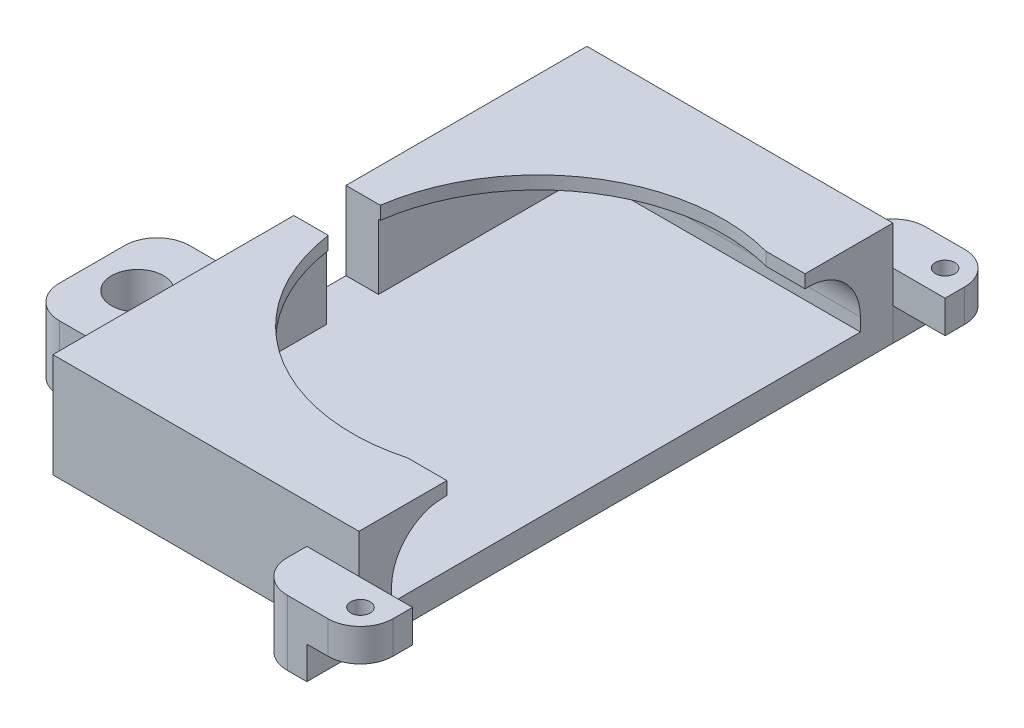
from build123d import *

# Parameters (mm, degrees)
BOSS_EXTRUDE2_DEPTH   = 14
CUT_EXTRUDE1_START    = -10
CUT_EXTRUDE1_DEPTH    = 93.322536556
BOSS_EXTRUDE3_DEPTH   = 2
FILLET6_R             = 8
SKETCH7_W             = 0.005
SKETCH7_H             = 82
CUT_EXTRUDE3_DEPTH    = 83.686153771
BOSS_EXTRUDE4_DEPTH   = 8
BOSS_EXTRUDE5_START   = -2
SKETCH12_W            = 8.228592419
SKETCH12_H            = 4.95
BOSS_EXTRUDE5_DEPTH   = 10
SKETCH9_R             = 1.5
CUT_EXTRUDE4_DEPTH    = 87.029065006
BOSS_EXTRUDE6_DEPTH   = 8
BOSS_EXTRUDE15_START  = -2
SKETCH15_W            = 7.945
SKETCH15_H            = 4.95
BOSS_EXTRUDE15_DEPTH  = 10
SKETCH16_R            = 1.5
CUT_EXTRUDE5_DEPTH    = 87.029065006
FILLET9_R             = 5
FILLET10_R            = 5
FILLET11_R            = 5
FILLET12_R            = 5
FILLET13_R            = 5
BOSS_EXTRUDE16_START  = -4
BOSS_EXTRUDE16_DEPTH  = 10
SKETCH18_R            = 4
CUT_EXTRUDE6_DEPTH    = 93.915997839
SKETCH19_W            = 20
SKETCH19_H            = 10
BOSS_EXTRUDE17_DEPTH  = 15
SKETCH20_R            = 4
CUT_EXTRUDE7_DEPTH    = 93.915997839
FILLET14_R            = 5
CUT_EXTRUDE9_START    = -5.282098
SKETCH21_W            = 8
SKETCH21_H            = 12
CUT_EXTRUDE9_DEPTH    = 5.282098
CROQUIS1_W            = 114.881967112
CROQUIS1_H            = 161.64199769
CORTAR_EXTRUIR2_DEPTH = 4.95
CROQUIS2_W            = 88.205530212
CROQUIS2_H            = 82
CORTAR_EXTRUIR3_DEPTH = 51.95


with BuildPart() as part:
    # Sketch1 → Boss-Extrude2 (new body)
    with BuildSketch(Plane(origin=(0, 0, 0), x_dir=(1, 0, 0), z_dir=(0, 1, 0))):
        with BuildLine():
            Line((0, 41), (-47, 41))
            Line((-47, 41), (-47, -41))
            Line((-47, -41), (0, -41))
            add(Edge.make_bspline(
                [(0, -41), (70, -41), (70, 0), (70, 41), (0, 41)],
                knots=[4.71238898, 4.71238898, 4.71238898, 6.283185307, 6.283185307, 7.853981634, 7.853981634, 7.853981634], degree=2, weights=[1, 0.707106781, 1, 0.707106781, 1]))
        make_face()
    extrude(amount=BOSS_EXTRUDE2_DEPTH)

    # Sketch3 → Cut-Extrude1 (cut, through all)
    with BuildSketch(Plane(origin=(0, 14, 0), x_dir=(1, 0, 0), z_dir=(0, 1, 0)).offset(CUT_EXTRUDE1_START)):
        with BuildLine():
            Line((0, 36), (-42, 36))
            Line((-42, 36), (-42, -36))
            Line((-42, -36), (0, -36))
            add(Edge.make_bspline(
                [(0, -36), (65, -36), (65, 0), (65, 36), (0, 36)],
                knots=[4.71238898, 4.71238898, 4.71238898, 6.283185307, 6.283185307, 7.853981634, 7.853981634, 7.853981634], degree=2, weights=[1, 0.707106781, 1, 0.707106781, 1]))
        make_face()
    extrude(amount=CUT_EXTRUDE1_DEPTH, mode=Mode.SUBTRACT)

    # Sketch5 → Boss-Extrude3 (add)
    with BuildSketch(Plane(origin=(0, 14, 0), x_dir=(1, 0, 0), z_dir=(0, 1, 0))):
        with BuildLine():
            Line((-47, 41), (-47, -41))
            Line((-47, -41), (0, -41))
            add(Edge.make_bspline(
                [(0, -41), (70, -41), (70, 0), (70, 41), (0, 41)],
                knots=[4.71238898, 4.71238898, 4.71238898, 6.283185307, 6.283185307, 7.853981634, 7.853981634, 7.853981634], degree=2, weights=[1, 0.707106781, 1, 0.707106781, 1]))
            Line((0, 41), (-47, 41))
        make_face()
        with BuildLine():
            Line((8.5, 27.5), (-6.016685226, 27.5))
            ThreePointArc((-6.016685226, 27.5), (-42, 0), (-6.016685226, -27.5))
            Line((-6.016685226, -27.5), (8.5, -27.5))
            add(Edge.make_bspline(
                [(8.5, -27.5), (58.152777778, -27.5), (58.152777778, 0), (58.152777778, 27.5), (8.5, 27.5)],
                knots=[1.570796327, 1.570796327, 1.570796327, 3.141592654, 3.141592654, 4.71238898, 4.71238898, 4.71238898], degree=2, weights=[1, 0.707106781, 1, 0.707106781, 1]))
        make_face(mode=Mode.SUBTRACT)
    extrude(amount=BOSS_EXTRUDE3_DEPTH)

    # Fillet6
    fillet6_edges = [part.edges().sort_by_distance(p)[0] for p in [
        (-21, 14, 36),
        (65, 14, 0),
        (-21, 14, -36),
    ]]
    fillet(fillet6_edges, radius=FILLET6_R)

    # Sketch7 → Cut-Extrude3 (cut, through all)
    with BuildSketch(Plane(origin=(0, 16, 0), x_dir=(1, 0, 0), z_dir=(0, 1, 0))):
        with Locations((-0.0025, 0)):
            Rectangle(SKETCH7_W, SKETCH7_H)
    extrude(amount=-CUT_EXTRUDE3_DEPTH, mode=Mode.SUBTRACT)


with BuildPart() as cut_extrude3_piece_1:
    # of the separate pieces the step leaves, piece 1, a body of its own (cut_extrude3_pieces)
    add(part.part.solids().sort_by_distance((0, 6, -36))[0])

    # Sketch12 → Boss-Extrude5 (add)
    with BuildSketch(Plane.XY.offset(41).offset(BOSS_EXTRUDE5_START)):
        with Locations((4.114296209, 2.475)):
            Rectangle(SKETCH12_W, SKETCH12_H)
    extrude(amount=BOSS_EXTRUDE5_DEPTH)


with BuildPart() as cut_extrude3_piece_2:
    # of the separate pieces the step leaves, piece 2, a body of its own (cut_extrude3_pieces)
    add(part.part.solids().sort_by_distance((-42, 14, -28))[0])

    # Sketch8 → Boss-Extrude4 (add)
    with BuildSketch(Plane.XY.offset(41)):
        Polygon((-8.005, 0), (-0.005, 0), (-0.005, 5), (8.228592419, 5), (8.228592419, 10), (0, 10), (-8.005, 10), align=None)
    extrude(amount=BOSS_EXTRUDE4_DEPTH)


with BuildPart() as cut_extrude4_tool:
    # Sketch9 → Cut-Extrude4 (new, through all)
    with BuildSketch(Plane(origin=(0, 10, 0), x_dir=(1, 0, 0), z_dir=(0, 1, 0))):
        with Locations(Location((4.228592419, -45, 0), (0, 0, 270))):
            Circle(SKETCH9_R)
    extrude(amount=-CUT_EXTRUDE4_DEPTH)


with BuildPart() as cut_extrude3_piece_1_1:
    add(cut_extrude3_piece_1.part)

    # Cut-Extrude4: cut by cut_extrude4_tool
    add(cut_extrude4_tool.part, mode=Mode.SUBTRACT)

    # Sketch15 → Boss-Extrude15 (add)
    with BuildSketch(Plane(origin=(0, 0, -41), x_dir=(-1, 0, 0), z_dir=(0, 0, -1)).offset(BOSS_EXTRUDE15_START)):
        with Locations((-4.0225, 2.475)):
            Rectangle(SKETCH15_W, SKETCH15_H)
    extrude(amount=BOSS_EXTRUDE15_DEPTH)


with BuildPart() as cut_extrude3_piece_2_1:
    add(cut_extrude3_piece_2.part)

    # Cut-Extrude4: cut by cut_extrude4_tool
    add(cut_extrude4_tool.part, mode=Mode.SUBTRACT)

    # Sketch14 → Boss-Extrude6 (add)
    with BuildSketch(Plane(origin=(0, 0, -41), x_dir=(-1, 0, 0), z_dir=(0, 0, -1))):
        Polygon((8.005, 0), (0, 0), (0, 5), (-7.995, 5), (-7.995, 10), (8.005, 10), align=None)
    extrude(amount=BOSS_EXTRUDE6_DEPTH)


with BuildPart() as cut_extrude5_tool:
    # Sketch16 → Cut-Extrude5 (new, through all)
    with BuildSketch(Plane(origin=(0, 10, 0), x_dir=(1, 0, 0), z_dir=(0, 1, 0))):
        with Locations(Location((3.995, 45, 0), (0, 0, 180))):
            Circle(SKETCH16_R)
    extrude(amount=-CUT_EXTRUDE5_DEPTH)


with BuildPart() as cut_extrude3_piece_1_2:
    add(cut_extrude3_piece_1_1.part)

    # Cut-Extrude5: cut by cut_extrude5_tool
    add(cut_extrude5_tool.part, mode=Mode.SUBTRACT)

    # Fillet10
    fillet10_edges = [cut_extrude3_piece_1_2.edges().sort_by_distance(p)[0] for p in [
        (7.995, 2.475, -49),
    ]]
    fillet(fillet10_edges, radius=FILLET10_R)

    # Fillet13
    fillet13_edges = [cut_extrude3_piece_1_2.edges().sort_by_distance(p)[0] for p in [
        (8.228592419, 2.475, 49),
    ]]
    fillet(fillet13_edges, radius=FILLET13_R)

    # Sketch13 → Boss-Extrude16 (add)
    with BuildSketch(Plane(origin=(0, 4, 0), x_dir=(1, 0, 0), z_dir=(0, 1, 0)).offset(BOSS_EXTRUDE16_START)):
        with BuildLine():
            Line((77.862579899, -17.449607958), (68.480918968, 8.495153988))
            add(Edge.make_bspline(
                [(25.721063073, -38.131875474), (80.737725462, -25.400755175), (68.480918968, 8.495153988)],
                knots=[5.088647992, 5.088647992, 5.088647992, 6.491896136, 6.491896136, 6.491896136], degree=2, weights=[1, 0.763794923, 1]))
            Line((25.721063073, -38.131875474), (72.500386182, -27.306915105))
            ThreePointArc((72.500386182, -27.306915105), (77.397822901, -23.583909635), (77.862579899, -17.449607958))
        make_face()
    extrude(amount=BOSS_EXTRUDE16_DEPTH)

    # Sketch18 → Cut-Extrude6 (cut, through all)
    with BuildSketch(Plane(origin=(0, 10, 0), x_dir=(1, 0, 0), z_dir=(0, 1, 0))):
        with Locations(Location((70.809530882, -20, 0), (0, 0, 270))):
            Circle(SKETCH18_R)
    extrude(amount=-CUT_EXTRUDE6_DEPTH, mode=Mode.SUBTRACT)

    # Croquis1 → Cortar-Extruir2 (cut)
    with BuildSketch(Plane(origin=(0, 0, 0), x_dir=(-1, 0, 0), z_dir=(0, -1, 0))):
        with Locations((-57.440983556, 31.820998845)):
            Rectangle(CROQUIS1_W, CROQUIS1_H)
    extrude(amount=-CORTAR_EXTRUIR2_DEPTH, mode=Mode.SUBTRACT)

    # Croquis2 → Cortar-Extruir3 (cut)
    with BuildSketch(Plane(origin=(0, 4.95, 0), x_dir=(-1, 0, 0), z_dir=(0, -1, 0))):
        with Locations((-44.102765106, 0)):
            Rectangle(CROQUIS2_W, CROQUIS2_H)
    extrude(amount=-CORTAR_EXTRUIR3_DEPTH, mode=Mode.SUBTRACT)


with BuildPart() as cut_extrude3_piece_2_2:
    add(cut_extrude3_piece_2_1.part)

    # Cut-Extrude5: cut by cut_extrude5_tool
    add(cut_extrude5_tool.part, mode=Mode.SUBTRACT)

    # Fillet9
    fillet9_edges = [cut_extrude3_piece_2_2.edges().sort_by_distance(p)[0] for p in [
        (7.995, 7.5, -49),
    ]]
    fillet(fillet9_edges, radius=FILLET9_R)

    # Fillet11
    fillet11_edges = [cut_extrude3_piece_2_2.edges().sort_by_distance(p)[0] for p in [
        (-8.005, 5, -49),
    ]]
    fillet(fillet11_edges, radius=FILLET11_R)

    # Fillet12
    fillet12_edges = [cut_extrude3_piece_2_2.edges().sort_by_distance(p)[0] for p in [
        (-8.005, 5, 49),
        (8.228592419, 7.5, 49),
    ]]
    fillet(fillet12_edges, radius=FILLET12_R)

    # Sketch19 → Boss-Extrude17 (add)
    with BuildSketch(Plane.ZY.offset(47)):
        with Locations((20, 5)):
            Rectangle(SKETCH19_W, SKETCH19_H)
    extrude(amount=BOSS_EXTRUDE17_DEPTH)

    # Sketch20 → Cut-Extrude7 (cut, through all)
    with BuildSketch(Plane(origin=(0, 10, 0), x_dir=(1, 0, 0), z_dir=(0, 1, 0))):
        with Locations(Location((-55, -20, 0), (0, 0, 270))):
            Circle(SKETCH20_R)
    extrude(amount=-CUT_EXTRUDE7_DEPTH, mode=Mode.SUBTRACT)

    # Fillet14
    fillet14_edges = [cut_extrude3_piece_2_2.edges().sort_by_distance(p)[0] for p in [
        (-62, 5, 10),
        (-62, 5, 30),
    ]]
    fillet(fillet14_edges, radius=FILLET14_R)

    # Sketch21 → Cut-Extrude9 (cut)
    with BuildSketch(Plane.ZY.offset(47).offset(CUT_EXTRUDE9_START)):
        with Locations((0, 10)):
            Rectangle(SKETCH21_W, SKETCH21_H)
    extrude(amount=CUT_EXTRUDE9_DEPTH, mode=Mode.SUBTRACT)


solid = cut_extrude3_piece_2_2.part
